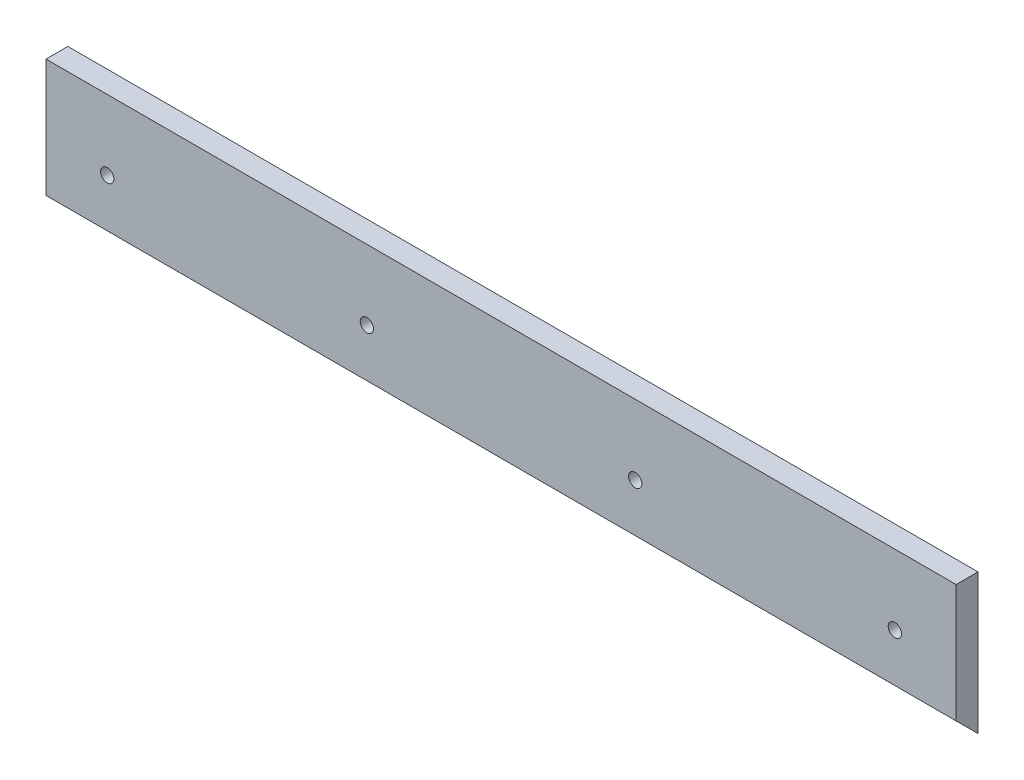
from build123d import *

# Parameters (mm, degrees)
SKETCH1_W               = 660.4
SKETCH1_H               = 101.6
BOSS_EXTRUDE1_DEPTH     = 7.9375
CUT_EXTRUDE2_DEPTH      = 663.398523478
CUT_EXTRUDE2_DEPTH_BACK = 663.398523478
CUT_EXTRUDE3_DEPTH      = 335.461799949
CUT_EXTRUDE3_DEPTH_BACK = 335.461799949
SKETCH4_R               = 4.826
SKETCH4_3_R             = 13.1826
SKETCH4_3_R_2           = 4.826
CUT_EXTRUDE4_DEPTH      = 8.128


with BuildPart() as part:
    # Sketch1 → Boss-Extrude1 (new, symmetric)
    with BuildSketch(Plane.XY):
        Rectangle(SKETCH1_W, SKETCH1_H)
    extrude(amount=BOSS_EXTRUDE1_DEPTH, both=True)

    # Sketch3 → Cut-Extrude2 (cut, two sides: drawn at the far end of the back side and taken through both)
    with BuildSketch(Plane(origin=(330.2, 0, 0), x_dir=(0, 0, -1), z_dir=(1, 0, 0)).offset(-CUT_EXTRUDE2_DEPTH_BACK)):
        Polygon((7.9375, -50.8), (-7.9375, -34.925), (-7.9375, -50.8), align=None)
    extrude(amount=CUT_EXTRUDE2_DEPTH + CUT_EXTRUDE2_DEPTH_BACK, mode=Mode.SUBTRACT)

    # Sketch4 → Cut-Extrude3 (cut, two sides: drawn at the far end of the back side and taken through both)
    with BuildSketch(Plane(origin=(0, 0, -7.9375), x_dir=(-1, 0, 0), z_dir=(0, 0, -1)).offset(-CUT_EXTRUDE3_DEPTH_BACK)):
        with Locations((-285.75, 0)):
            Circle(SKETCH4_R)
        with Locations((-97.366666667, 0)):
            Circle(SKETCH4_R)
        with Locations((97.366666667, 0)):
            Circle(SKETCH4_R)
        with Locations((285.75, 0)):
            Circle(SKETCH4_R)
    extrude(amount=CUT_EXTRUDE3_DEPTH + CUT_EXTRUDE3_DEPTH_BACK, mode=Mode.SUBTRACT)

    # Sketch4<3> → Cut-Extrude4 (cut)
    # profile 1 of 4: a face of its own
    with BuildSketch(Plane(origin=(0, 0, -7.9375), x_dir=(-1, 0, 0), z_dir=(0, 0, -1))):
        with Locations((-285.75, 0)):
            Circle(SKETCH4_3_R)
        with Locations((-285.75, 0)):
            Circle(SKETCH4_3_R_2, mode=Mode.SUBTRACT)
    # profile 2 of 4: a face of its own
    with BuildSketch(Plane(origin=(0, 0, -7.9375), x_dir=(-1, 0, 0), z_dir=(0, 0, -1))):
        with Locations((-97.366666667, 0)):
            Circle(SKETCH4_3_R)
        with Locations((-97.366666667, 0)):
            Circle(SKETCH4_3_R_2, mode=Mode.SUBTRACT)
    # profile 3 of 4: a face of its own
    with BuildSketch(Plane(origin=(0, 0, -7.9375), x_dir=(-1, 0, 0), z_dir=(0, 0, -1))):
        with Locations((285.75, 0)):
            Circle(SKETCH4_3_R)
        with Locations((285.75, 0)):
            Circle(SKETCH4_3_R_2, mode=Mode.SUBTRACT)
    # profile 4 of 4: a face of its own
    with BuildSketch(Plane(origin=(0, 0, -7.9375), x_dir=(-1, 0, 0), z_dir=(0, 0, -1))):
        with Locations((97.366666667, 0)):
            Circle(SKETCH4_3_R)
        with Locations((97.366666667, 0)):
            Circle(SKETCH4_3_R_2, mode=Mode.SUBTRACT)
    extrude(amount=-CUT_EXTRUDE4_DEPTH, mode=Mode.SUBTRACT)


solid = part.part
